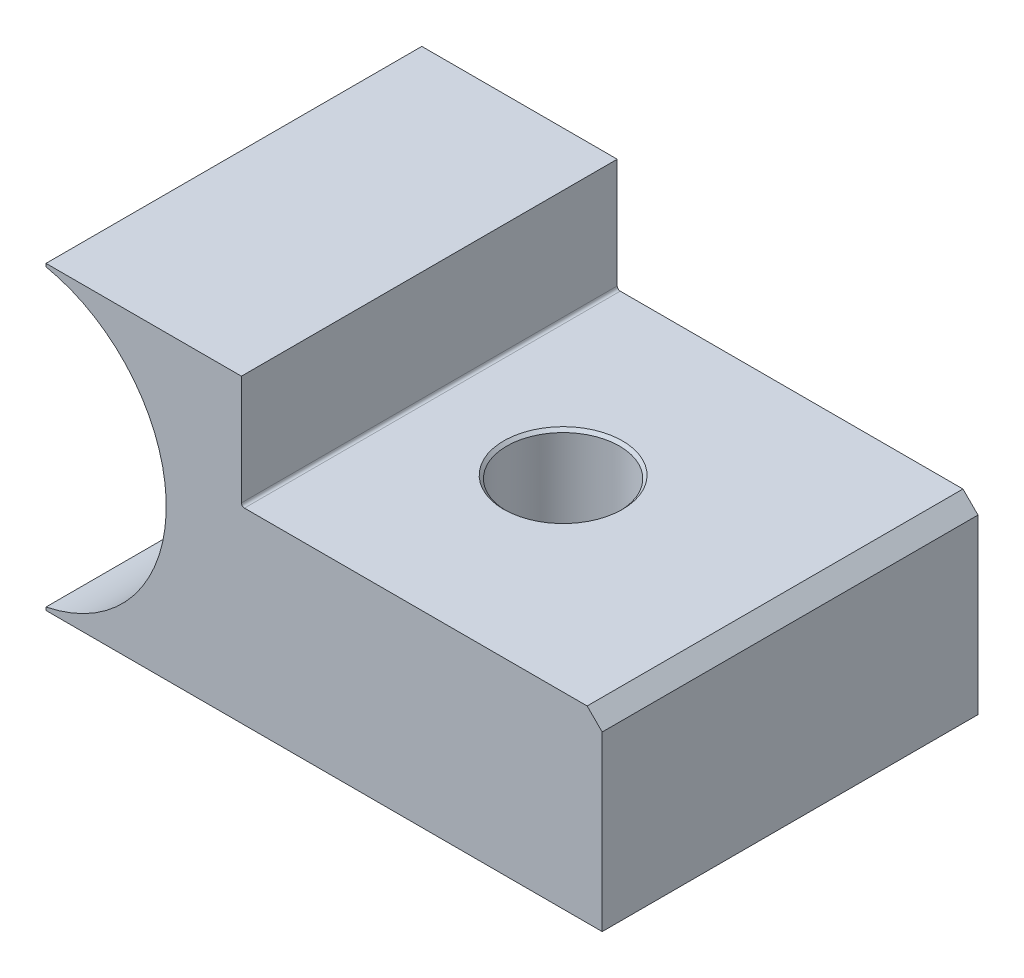
from build123d import *

# Parameters (mm, degrees)
BOSS_EXTRUDE1_DEPTH          = 31.75
F_3_8_0_375_DIAMETER_HOLE1_D = 9.525
CHAMFER1_SIZE                = 1.27
CHAMFER2_SIZE                = 0.254
FILLET1_R                    = 0.254


with BuildPart() as part:
    # Sketch1 → Boss-Extrude1 (new body)
    with BuildSketch(Plane.XY):
        with BuildLine():
            Line((2.54, 0), (49.53, 0))
            Line((49.53, 0), (49.53, 15.875))
            Line((49.53, 15.875), (19.05, 15.875))
            Line((19.05, 15.875), (19.05, 25.4))
            Line((19.05, 25.4), (2.54, 25.4))
            Line((2.54, 25.4), (2.54, 25.143407893))
            ThreePointArc((2.54, 25.143407893), (12.7, 12.7), (2.54, 0.256592107))
            Line((2.54, 0.256592107), (2.54, 0))
        make_face()
    extrude(amount=BOSS_EXTRUDE1_DEPTH)

    # 3/8 (0.375) Diameter Hole1 (through all)
    with Locations(Plane(origin=(0, 15.875, 0), x_dir=(1, 0, 0), z_dir=(0, 1, 0))):
        with Locations((30.353, -15.875)):
            Hole(F_3_8_0_375_DIAMETER_HOLE1_D / 2)

    # Chamfer1
    chamfer1_edges = [part.edges().sort_by_distance(p)[0] for p in [
        (49.53, 15.875, 15.875),
    ]]
    chamfer(chamfer1_edges, length=CHAMFER1_SIZE)

    # Chamfer2
    chamfer2_edges = [part.edges().sort_by_distance(p)[0] for p in [
        (35.1155, 15.875, 15.875),
    ]]
    chamfer(chamfer2_edges, length=CHAMFER2_SIZE)

    # Fillet1
    fillet1_edges = [part.edges().sort_by_distance(p)[0] for p in [
        (19.05, 15.875, 15.875),
    ]]
    fillet(fillet1_edges, radius=FILLET1_R)


solid = part.part
